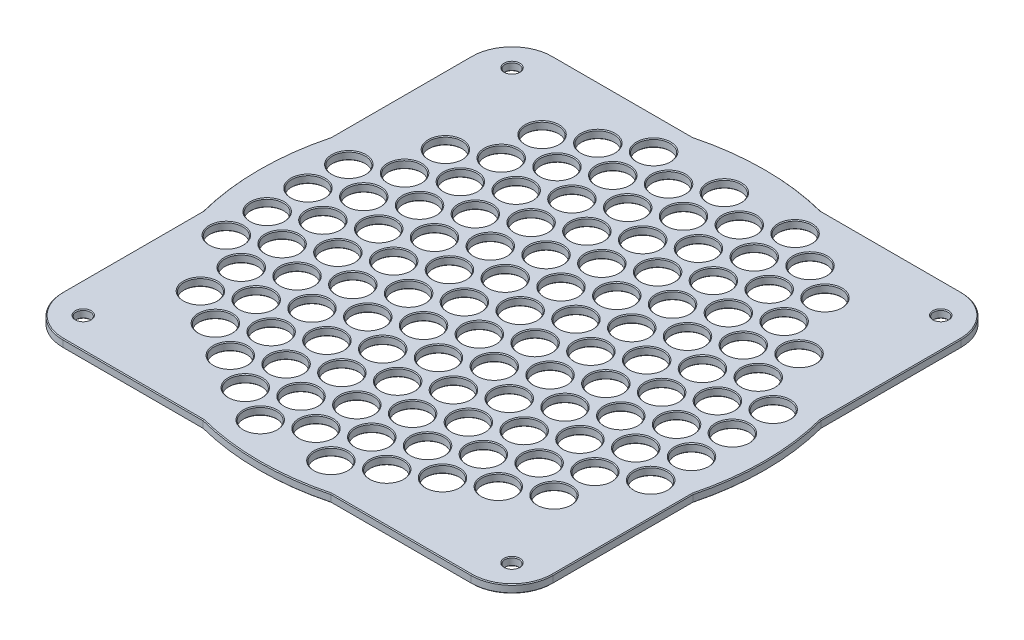
from build123d import *

# Parameters (mm, degrees)
SKETCH_1_R          = 62
EXTRUDE_1_DEPTH     = 2
SKETCH_2_R          = 4
CUT_EXTRUDE_1_DEPTH = 88.704047797
OTHER_1_OUTLINE_R   = 4
OTHER_1_DEPTH       = 2
SKETCH_4_R          = 1.75
EXTRUDE_2_DEPTH     = 2
FILLET_1_R          = 10
CHAMFER_1_SIZE      = 0.2


# Read off the part's stored shape, not the designer's step: 填充阵列1
with BuildPart() as part:
    # 草图1 → 凸台-拉伸1 (new body)
    with BuildSketch(Plane(origin=(0, 0, 0), x_dir=(1, 0, 0), z_dir=(0, 1, 0))):
        with Locations(Location((0, 0, 0), (0, 0, 270))):
            Circle(SKETCH_1_R)
    extrude(amount=EXTRUDE_1_DEPTH)

    # 草图2 → 切除-拉伸1 (cut, through all)
    with BuildSketch(Plane(origin=(0, 2, 0), x_dir=(1, 0, 0), z_dir=(0, 1, 0))):
        with Locations(Location((0, 52, 0), (0, 0, 270))):
            Circle(SKETCH_2_R)
    extrude(amount=-CUT_EXTRUDE_1_DEPTH, mode=Mode.SUBTRACT)

    # 填充阵列1 outline → 填充阵列1 (cut)
    with BuildSketch(Plane(origin=(0, 0, 0), x_dir=(1, 0, 0), z_dir=(0, 1, 0))):
        with Locations((17.320508076, 52)):
            Circle(OTHER_1_OUTLINE_R)
        with Locations((0, -28)):
            Circle(OTHER_1_OUTLINE_R)
        with Locations((-8.660254038, -23)):
            Circle(OTHER_1_OUTLINE_R)
        with Locations((-17.320508076, -18)):
            Circle(OTHER_1_OUTLINE_R)
        with Locations((-25.980762114, -13)):
            Circle(OTHER_1_OUTLINE_R)
        with Locations((34.641016151, -38)):
            Circle(OTHER_1_OUTLINE_R)
        with Locations((-51.961524227, 2)):
            Circle(OTHER_1_OUTLINE_R)
        with Locations((-43.301270189, -3)):
            Circle(OTHER_1_OUTLINE_R)
        with Locations((-34.641016151, -8)):
            Circle(OTHER_1_OUTLINE_R)
        with Locations((-17.320508076, -28)):
            Circle(OTHER_1_OUTLINE_R)
        with Locations((-25.980762114, -23)):
            Circle(OTHER_1_OUTLINE_R)
        with Locations((-34.641016151, -18)):
            Circle(OTHER_1_OUTLINE_R)
        with Locations((-43.301270189, -13)):
            Circle(OTHER_1_OUTLINE_R)
        with Locations((8.660254038, -33)):
            Circle(OTHER_1_OUTLINE_R)
        with Locations((17.320508076, -38)):
            Circle(OTHER_1_OUTLINE_R)
        with Locations((25.980762114, -43)):
            Circle(OTHER_1_OUTLINE_R)
        with Locations((-51.961524227, -8)):
            Circle(OTHER_1_OUTLINE_R)
        with Locations((-43.301270189, 7)):
            Circle(OTHER_1_OUTLINE_R)
        with Locations((-51.961524227, 12)):
            Circle(OTHER_1_OUTLINE_R)
        with Locations((43.301270189, -33)):
            Circle(OTHER_1_OUTLINE_R)
        with Locations((34.641016151, -28)):
            Circle(OTHER_1_OUTLINE_R)
        with Locations((25.980762114, -23)):
            Circle(OTHER_1_OUTLINE_R)
        with Locations((17.320508076, -18)):
            Circle(OTHER_1_OUTLINE_R)
        with Locations((8.660254038, -13)):
            Circle(OTHER_1_OUTLINE_R)
        with Locations((0, -8)):
            Circle(OTHER_1_OUTLINE_R)
        with Locations((-34.641016151, 2)):
            Circle(OTHER_1_OUTLINE_R)
        with Locations((-25.980762114, -3)):
            Circle(OTHER_1_OUTLINE_R)
        with Locations((-17.320508076, -8)):
            Circle(OTHER_1_OUTLINE_R)
        with Locations((-8.660254038, -13)):
            Circle(OTHER_1_OUTLINE_R)
        with Locations((0, -18)):
            Circle(OTHER_1_OUTLINE_R)
        with Locations((8.660254038, -23)):
            Circle(OTHER_1_OUTLINE_R)
        with Locations((17.320508076, -28)):
            Circle(OTHER_1_OUTLINE_R)
        with Locations((25.980762114, -33)):
            Circle(OTHER_1_OUTLINE_R)
        with Locations((-8.660254038, -53)):
            Circle(OTHER_1_OUTLINE_R)
        with Locations((-8.660254038, -33)):
            Circle(OTHER_1_OUTLINE_R)
        with Locations((0, -38)):
            Circle(OTHER_1_OUTLINE_R)
        with Locations((8.660254038, -43)):
            Circle(OTHER_1_OUTLINE_R)
        with Locations((17.320508076, -48)):
            Circle(OTHER_1_OUTLINE_R)
        with Locations((-51.961524227, -18)):
            Circle(OTHER_1_OUTLINE_R)
        with Locations((-43.301270189, -23)):
            Circle(OTHER_1_OUTLINE_R)
        with Locations((-34.641016151, -28)):
            Circle(OTHER_1_OUTLINE_R)
        with Locations((-25.980762114, -33)):
            Circle(OTHER_1_OUTLINE_R)
        with Locations((-17.320508076, -48)):
            Circle(OTHER_1_OUTLINE_R)
        with Locations((-25.980762114, -43)):
            Circle(OTHER_1_OUTLINE_R)
        with Locations((-34.641016151, -38)):
            Circle(OTHER_1_OUTLINE_R)
        with Locations((-43.301270189, -33)):
            Circle(OTHER_1_OUTLINE_R)
        with Locations((8.660254038, -53)):
            Circle(OTHER_1_OUTLINE_R)
        with Locations((0, -48)):
            Circle(OTHER_1_OUTLINE_R)
        with Locations((-8.660254038, -43)):
            Circle(OTHER_1_OUTLINE_R)
        with Locations((-17.320508076, -38)):
            Circle(OTHER_1_OUTLINE_R)
        with Locations((-25.980762114, 47)):
            Circle(OTHER_1_OUTLINE_R)
        with Locations((-17.320508076, 42)):
            Circle(OTHER_1_OUTLINE_R)
        with Locations((-8.660254038, 37)):
            Circle(OTHER_1_OUTLINE_R)
        with Locations((0, 32)):
            Circle(OTHER_1_OUTLINE_R)
        with Locations((8.660254038, 27)):
            Circle(OTHER_1_OUTLINE_R)
        with Locations((17.320508076, 22)):
            Circle(OTHER_1_OUTLINE_R)
        with Locations((25.980762114, 17)):
            Circle(OTHER_1_OUTLINE_R)
        with Locations((34.641016151, 12)):
            Circle(OTHER_1_OUTLINE_R)
        with Locations((8.660254038, 17)):
            Circle(OTHER_1_OUTLINE_R)
        with Locations((0, 22)):
            Circle(OTHER_1_OUTLINE_R)
        with Locations((-8.660254038, 27)):
            Circle(OTHER_1_OUTLINE_R)
        with Locations((-17.320508076, 32)):
            Circle(OTHER_1_OUTLINE_R)
        with Locations((-25.980762114, 37)):
            Circle(OTHER_1_OUTLINE_R)
        with Locations((-34.641016151, 42)):
            Circle(OTHER_1_OUTLINE_R)
        with Locations((51.961524227, 2)):
            Circle(OTHER_1_OUTLINE_R)
        with Locations((43.301270189, 7)):
            Circle(OTHER_1_OUTLINE_R)
        with Locations((25.980762114, 37)):
            Circle(OTHER_1_OUTLINE_R)
        with Locations((34.641016151, 32)):
            Circle(OTHER_1_OUTLINE_R)
        with Locations((43.301270189, 27)):
            Circle(OTHER_1_OUTLINE_R)
        with Locations((-17.320508076, 52)):
            Circle(OTHER_1_OUTLINE_R)
        with Locations((17.320508076, 42)):
            Circle(OTHER_1_OUTLINE_R)
        with Locations((8.660254038, 47)):
            Circle(OTHER_1_OUTLINE_R)
        with Locations((34.641016151, 42)):
            Circle(OTHER_1_OUTLINE_R)
        with Locations((25.980762114, 47)):
            Circle(OTHER_1_OUTLINE_R)
        with Locations((-8.660254038, 47)):
            Circle(OTHER_1_OUTLINE_R)
        with Locations((0, 42)):
            Circle(OTHER_1_OUTLINE_R)
        with Locations((8.660254038, 37)):
            Circle(OTHER_1_OUTLINE_R)
        with Locations((17.320508076, 32)):
            Circle(OTHER_1_OUTLINE_R)
        with Locations((25.980762114, 27)):
            Circle(OTHER_1_OUTLINE_R)
        with Locations((34.641016151, 22)):
            Circle(OTHER_1_OUTLINE_R)
        with Locations((43.301270189, 17)):
            Circle(OTHER_1_OUTLINE_R)
        with Locations((51.961524227, 12)):
            Circle(OTHER_1_OUTLINE_R)
        with Locations((-43.301270189, 27)):
            Circle(OTHER_1_OUTLINE_R)
        with Locations((-34.641016151, 22)):
            Circle(OTHER_1_OUTLINE_R)
        with Locations((-25.980762114, 17)):
            Circle(OTHER_1_OUTLINE_R)
        with Locations((-17.320508076, 12)):
            Circle(OTHER_1_OUTLINE_R)
        with Locations((-8.660254038, 7)):
            Circle(OTHER_1_OUTLINE_R)
        with Locations((0, 2)):
            Circle(OTHER_1_OUTLINE_R)
        with Locations((8.660254038, -3)):
            Circle(OTHER_1_OUTLINE_R)
        with Locations((17.320508076, -8)):
            Circle(OTHER_1_OUTLINE_R)
        with Locations((-8.660254038, -3)):
            Circle(OTHER_1_OUTLINE_R)
        with Locations((-17.320508076, 2)):
            Circle(OTHER_1_OUTLINE_R)
        with Locations((-25.980762114, 7)):
            Circle(OTHER_1_OUTLINE_R)
        with Locations((-34.641016151, 12)):
            Circle(OTHER_1_OUTLINE_R)
        with Locations((25.980762114, -13)):
            Circle(OTHER_1_OUTLINE_R)
        with Locations((34.641016151, -18)):
            Circle(OTHER_1_OUTLINE_R)
        with Locations((43.301270189, -23)):
            Circle(OTHER_1_OUTLINE_R)
        with Locations((-43.301270189, 17)):
            Circle(OTHER_1_OUTLINE_R)
        with Locations((51.961524227, -8)):
            Circle(OTHER_1_OUTLINE_R)
        with Locations((-34.641016151, 32)):
            Circle(OTHER_1_OUTLINE_R)
        with Locations((-25.980762114, 27)):
            Circle(OTHER_1_OUTLINE_R)
        with Locations((-17.320508076, 22)):
            Circle(OTHER_1_OUTLINE_R)
        with Locations((43.301270189, -3)):
            Circle(OTHER_1_OUTLINE_R)
        with Locations((34.641016151, 2)):
            Circle(OTHER_1_OUTLINE_R)
        with Locations((25.980762114, 7)):
            Circle(OTHER_1_OUTLINE_R)
        with Locations((17.320508076, 12)):
            Circle(OTHER_1_OUTLINE_R)
        with Locations((-8.660254038, 17)):
            Circle(OTHER_1_OUTLINE_R)
        with Locations((0, 12)):
            Circle(OTHER_1_OUTLINE_R)
        with Locations((8.660254038, 7)):
            Circle(OTHER_1_OUTLINE_R)
        with Locations((17.320508076, 2)):
            Circle(OTHER_1_OUTLINE_R)
        with Locations((25.980762114, -3)):
            Circle(OTHER_1_OUTLINE_R)
        with Locations((34.641016151, -8)):
            Circle(OTHER_1_OUTLINE_R)
        with Locations((43.301270189, -13)):
            Circle(OTHER_1_OUTLINE_R)
        with Locations((51.961524227, -18)):
            Circle(OTHER_1_OUTLINE_R)
    extrude(amount=OTHER_1_DEPTH, mode=Mode.SUBTRACT)

    # 草图4 → 凸台-拉伸2 (add)
    # profile 1 of 4: a face of its own
    with BuildSketch(Plane(origin=(0, 0, 0), x_dir=(-1, 0, 0), z_dir=(0, -1, 0))):
        with BuildLine():
            Line((-14.806755215, -60), (-60, -60))
            Line((-60, -60), (-60, -14.806755215))
            ThreePointArc((-60, -14.806755215), (-43.699199077, -43.699199077), (-14.806755215, -60))
        make_face()
        with Locations(Location((-52.5, -52.5, 0), (0, 0, 90))):
            Circle(SKETCH_4_R, mode=Mode.SUBTRACT)
    # profile 2 of 4: a face of its own
    with BuildSketch(Plane(origin=(0, 0, 0), x_dir=(-1, 0, 0), z_dir=(0, -1, 0))):
        with BuildLine():
            Line((60, -60), (14.806755215, -60))
            ThreePointArc((14.806755215, -60), (43.699199077, -43.699199077), (60, -14.806755215))
            Line((60, -14.806755215), (60, -60))
        make_face()
        with Locations(Location((52.5, -52.5, 0), (0, 0, 90))):
            Circle(SKETCH_4_R, mode=Mode.SUBTRACT)
    # profile 3 of 4: a face of its own
    with BuildSketch(Plane(origin=(0, 0, 0), x_dir=(-1, 0, 0), z_dir=(0, -1, 0))):
        with BuildLine():
            Line((60, 60), (14.806755215, 60))
            ThreePointArc((14.806755215, 60), (43.699199077, 43.699199077), (60, 14.806755215))
            Line((60, 14.806755215), (60, 60))
        make_face()
        with Locations(Location((52.5, 52.5, 0), (0, 0, 90))):
            Circle(SKETCH_4_R, mode=Mode.SUBTRACT)
    # profile 4 of 4: a face of its own
    with BuildSketch(Plane(origin=(0, 0, 0), x_dir=(-1, 0, 0), z_dir=(0, -1, 0))):
        with BuildLine():
            Line((-14.806755215, 60), (-60, 60))
            Line((-60, 60), (-60, 14.806755215))
            ThreePointArc((-60, 14.806755215), (-43.699199077, 43.699199077), (-14.806755215, 60))
        make_face()
        with Locations(Location((-52.5, 52.5, 0), (0, 0, 90))):
            Circle(SKETCH_4_R, mode=Mode.SUBTRACT)
    extrude(amount=-EXTRUDE_2_DEPTH)

    # 圆角1
    fillet_1_edges = [part.edges().sort_by_distance(p)[0] for p in [
        (-60, 1, 60),
        (60, 1, -60),
        (-60, 1, -60),
        (60, 1, 60),
    ]]
    fillet(fillet_1_edges, radius=FILLET_1_R)

    # 倒角1
    chamfer_1_edges = [part.edges().sort_by_distance(p)[0] for p in [
        (47.961524227, 0, 18),
        (47.961524227, 2, 18),
        (39.301270189, 0, 13),
        (39.301270189, 2, 13),
        (30.641016151, 0, 8),
        (30.641016151, 2, 8),
        (21.980762114, 0, 3),
        (21.980762114, 2, 3),
        (13.320508076, 0, -2),
        (13.320508076, 2, -2),
        (4.660254038, 0, -7),
        (4.660254038, 2, -7),
        (-4, 0, -12),
        (-4, 2, -12),
        (-12.660254038, 0, -17),
        (-12.660254038, 2, -17),
        (13.320508076, 0, -12),
        (13.320508076, 2, -12),
        (21.980762114, 0, -7),
        (21.980762114, 2, -7),
        (30.641016151, 0, -2),
        (30.641016151, 2, -2),
        (39.301270189, 0, 3),
        (39.301270189, 2, 3),
        (-21.320508076, 0, -22),
        (-21.320508076, 2, -22),
        (-29.980762114, 0, -27),
        (-29.980762114, 2, -27),
        (-38.641016151, 0, -32),
        (-38.641016151, 2, -32),
        (47.961524227, 0, 8),
        (47.961524227, 2, 8),
        (-47.301270189, 0, -17),
        (-47.301270189, 2, -17),
        (39.301270189, 0, 23),
        (39.301270189, 2, 23),
        (30.641016151, 0, 18),
        (30.641016151, 2, 18),
        (21.980762114, 0, 13),
        (21.980762114, 2, 13),
        (-38.641016151, 0, -12),
        (-38.641016151, 2, -12),
        (-29.980762114, 0, -7),
        (-29.980762114, 2, -7),
        (-21.320508076, 0, -2),
        (-21.320508076, 2, -2),
        (-12.660254038, 0, 3),
        (-12.660254038, 2, 3),
        (13.320508076, 0, 8),
        (13.320508076, 2, 8),
        (4.660254038, 0, 3),
        (4.660254038, 2, 3),
        (-4, 0, -2),
        (-4, 2, -2),
        (-12.660254038, 0, -7),
        (-12.660254038, 2, -7),
        (-21.320508076, 0, -12),
        (-21.320508076, 2, -12),
        (-29.980762114, 0, -17),
        (-29.980762114, 2, -17),
        (-38.641016151, 0, -22),
        (-38.641016151, 2, -22),
        (-47.301270189, 0, -27),
        (-47.301270189, 2, -27),
        (47.961524227, 0, -12),
        (47.961524227, 2, -12),
        (39.301270189, 0, -17),
        (39.301270189, 2, -17),
        (30.641016151, 0, -22),
        (30.641016151, 2, -22),
        (21.980762114, 0, -27),
        (21.980762114, 2, -27),
        (13.320508076, 0, -32),
        (13.320508076, 2, -32),
        (4.660254038, 0, -37),
        (4.660254038, 2, -37),
        (-4, 0, -42),
        (-4, 2, -42),
        (-12.660254038, 0, -47),
        (-12.660254038, 2, -47),
        (21.980762114, 0, -47),
        (21.980762114, 2, -47),
        (30.641016151, 0, -42),
        (30.641016151, 2, -42),
        (4.660254038, 0, -47),
        (4.660254038, 2, -47),
        (13.320508076, 0, -42),
        (13.320508076, 2, -42),
        (-21.320508076, 0, -52),
        (-21.320508076, 2, -52),
        (39.301270189, 0, -27),
        (39.301270189, 2, -27),
        (30.641016151, 0, -32),
        (30.641016151, 2, -32),
        (21.980762114, 0, -37),
        (21.980762114, 2, -37),
        (39.301270189, 0, -7),
        (39.301270189, 2, -7),
        (47.961524227, 0, -2),
        (47.961524227, 2, -2),
        (-38.641016151, 0, -42),
        (-38.641016151, 2, -42),
        (-29.980762114, 0, -37),
        (-29.980762114, 2, -37),
        (-21.320508076, 0, -32),
        (-21.320508076, 2, -32),
        (-12.660254038, 0, -27),
        (-12.660254038, 2, -27),
        (-4, 0, -22),
        (-4, 2, -22),
        (4.660254038, 0, -17),
        (4.660254038, 2, -17),
        (30.641016151, 0, -12),
        (30.641016151, 2, -12),
        (21.980762114, 0, -17),
        (21.980762114, 2, -17),
        (13.320508076, 0, -22),
        (13.320508076, 2, -22),
        (4.660254038, 0, -27),
        (4.660254038, 2, -27),
        (-4, 0, -32),
        (-4, 2, -32),
        (-12.660254038, 0, -37),
        (-12.660254038, 2, -37),
        (-21.320508076, 0, -42),
        (-21.320508076, 2, -42),
        (-29.980762114, 0, -47),
        (-29.980762114, 2, -47),
        (-21.320508076, 0, 38),
        (-21.320508076, 2, 38),
        (-12.660254038, 0, 43),
        (-12.660254038, 2, 43),
        (-4, 0, 48),
        (-4, 2, 48),
        (4.660254038, 0, 53),
        (4.660254038, 2, 53),
        (-47.301270189, 0, 33),
        (-47.301270189, 2, 33),
        (-38.641016151, 0, 38),
        (-38.641016151, 2, 38),
        (-29.980762114, 0, 43),
        (-29.980762114, 2, 43),
        (-21.320508076, 0, 48),
        (-21.320508076, 2, 48),
        (-29.980762114, 0, 33),
        (-29.980762114, 2, 33),
        (-38.641016151, 0, 28),
        (-38.641016151, 2, 28),
        (-47.301270189, 0, 23),
        (-47.301270189, 2, 23),
        (-55.961524227, 0, 18),
        (-55.961524227, 2, 18),
        (13.320508076, 0, 48),
        (13.320508076, 2, 48),
        (4.660254038, 0, 43),
        (4.660254038, 2, 43),
        (-4, 0, 38),
        (-4, 2, 38),
        (-12.660254038, 0, 33),
        (-12.660254038, 2, 33),
        (-12.660254038, 0, 53),
        (-12.660254038, 2, 53),
        (21.980762114, 0, 33),
        (21.980762114, 2, 33),
        (13.320508076, 0, 28),
        (13.320508076, 2, 28),
        (4.660254038, 0, 23),
        (4.660254038, 2, 23),
        (-4, 0, 18),
        (-4, 2, 18),
        (-12.660254038, 0, 13),
        (-12.660254038, 2, 13),
        (-21.320508076, 0, 8),
        (-21.320508076, 2, 8),
        (-29.980762114, 0, 3),
        (-29.980762114, 2, 3),
        (-38.641016151, 0, -2),
        (-38.641016151, 2, -2),
        (-4, 0, 8),
        (-4, 2, 8),
        (4.660254038, 0, 13),
        (4.660254038, 2, 13),
        (13.320508076, 0, 18),
        (13.320508076, 2, 18),
        (21.980762114, 0, 23),
        (21.980762114, 2, 23),
        (30.641016151, 0, 28),
        (30.641016151, 2, 28),
        (39.301270189, 0, 33),
        (39.301270189, 2, 33),
        (-55.961524227, 0, -12),
        (-55.961524227, 2, -12),
        (-47.301270189, 0, -7),
        (-47.301270189, 2, -7),
        (-55.961524227, 0, 8),
        (-55.961524227, 2, 8),
        (21.980762114, 0, 43),
        (21.980762114, 2, 43),
        (13.320508076, 0, 38),
        (13.320508076, 2, 38),
        (4.660254038, 0, 33),
        (4.660254038, 2, 33),
        (-47.301270189, 0, 13),
        (-47.301270189, 2, 13),
        (-38.641016151, 0, 18),
        (-38.641016151, 2, 18),
        (-29.980762114, 0, 23),
        (-29.980762114, 2, 23),
        (-21.320508076, 0, 28),
        (-21.320508076, 2, 28),
        (-38.641016151, 0, 8),
        (-38.641016151, 2, 8),
        (-47.301270189, 0, 3),
        (-47.301270189, 2, 3),
        (-55.961524227, 0, -2),
        (-55.961524227, 2, -2),
        (30.641016151, 0, 38),
        (30.641016151, 2, 38),
        (-29.980762114, 0, 13),
        (-29.980762114, 2, 13),
        (-21.320508076, 0, 18),
        (-21.320508076, 2, 18),
        (-12.660254038, 0, 23),
        (-12.660254038, 2, 23),
        (-4, 0, 28),
        (-4, 2, 28),
        (13.320508076, 0, -52),
        (13.320508076, 2, -52),
        (0, 0, 62),
        (0, 2, 62),
        (-32.810249676, 2, 60),
        (-52.5, 0, 54.25),
        (-32.810249676, 0, 60),
        (-52.5, 2, 54.25),
        (0, 0, -62),
        (0, 2, -62),
        (32.810249676, 2, -60),
        (52.5, 0, -50.75),
        (32.810249676, 0, -60),
        (52.5, 2, -50.75),
        (-62, 0, 0),
        (-62, 2, 0),
        (-60, 2, -32.810249676),
        (-52.5, 0, -50.75),
        (-60, 0, -32.810249676),
        (-52.5, 2, -50.75),
        (62, 0, 0),
        (62, 2, 0),
        (60, 2, 32.810249676),
        (52.5, 0, 54.25),
        (60, 0, 32.810249676),
        (52.5, 2, 54.25),
        (32.810249676, 0, 60),
        (-60, 0, 32.810249676),
        (-32.810249676, 0, -60),
        (60, 0, -32.810249676),
        (57.071067812, 0, -57.071067812),
        (57.071067812, 0, 57.071067812),
        (-57.071067812, 0, 57.071067812),
        (-57.071067812, 0, -57.071067812),
        (-32.810249676, 2, -60),
        (32.810249676, 2, 60),
        (60, 2, -32.810249676),
        (-60, 2, 32.810249676),
        (57.071067812, 2, -57.071067812),
        (57.071067812, 2, 57.071067812),
        (-57.071067812, 2, 57.071067812),
        (-57.071067812, 2, -57.071067812),
        (0, 0, -56),
        (0, 2, -56),
    ]]
    chamfer(chamfer_1_edges, length=CHAMFER_1_SIZE)


solid = part.part
